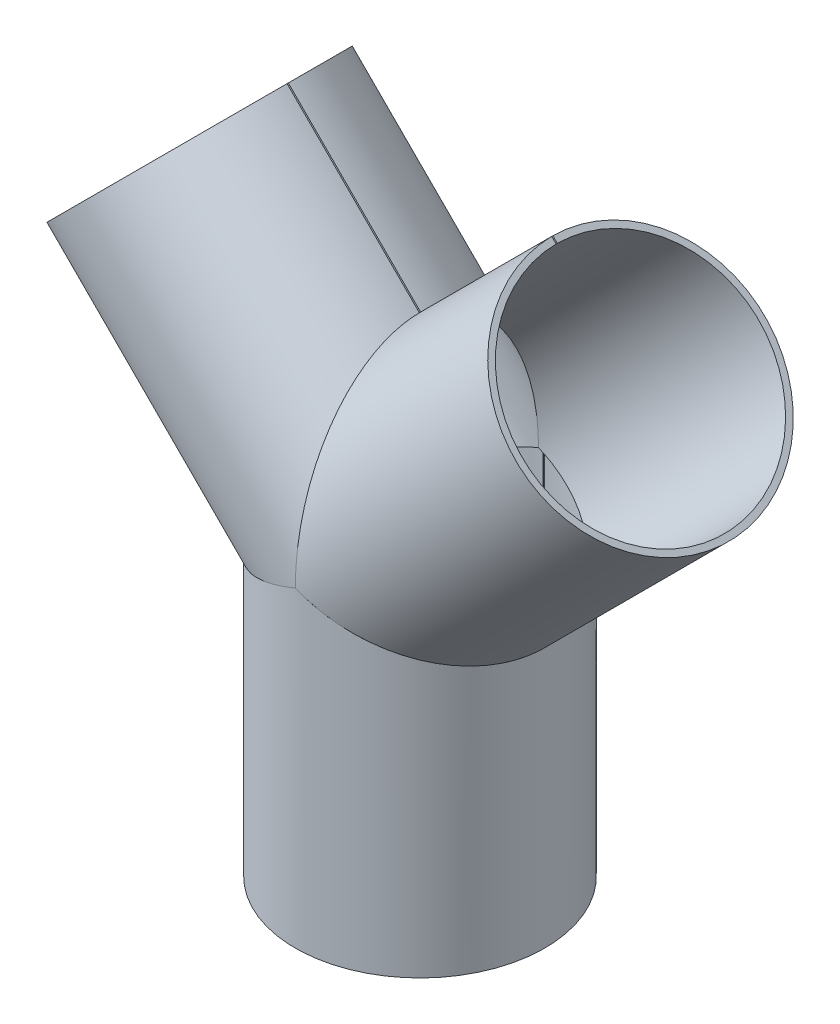
from build123d import *

# Parameters (mm, degrees)
BASE_FLANGE1_START      = -500
BASE_FLANGE1_DEPTH      = 500
CUT_EXTRUDE1_DEPTH      = 729.009787024
CUT_EXTRUDE1_DEPTH_BACK = 729.009787024
BASE_FLANGE2_DEPTH      = 500
CUT_EXTRUDE6_DEPTH      = 729.009787024
CUT_EXTRUDE6_DEPTH_BACK = 729.009787024
BASE_FLANGE3_DEPTH      = 500
CUT_EXTRUDE7_DEPTH      = 732.436941916
CUT_EXTRUDE7_DEPTH_BACK = 732.436941916


# Read off the part's stored shape, not the designer's step: Base-Flange1
# Sheet-metal steps are written as plain solids
with BuildPart() as part:
    # Base-Flange1 outline → Base-Flange1 (new body)
    with BuildSketch(Plane(origin=(353.553390593, 353.553390593, 0), x_dir=(0.7071067811865486, -0.7071067811865465, 0), z_dir=(0.7071067811865465, 0.7071067811865486, 0)).offset(BASE_FLANGE1_START)):
        with BuildLine():
            Line((-189.997625, -0.949997031), (-199.9975, -0.999996875))
            ThreePointArc((-199.9975, -0.999996875), (200, 0), (-199.9975, 0.999996875))
            Line((-199.9975, 0.999996875), (-189.997625, 0.949997031))
            ThreePointArc((-189.997625, 0.949997031), (190, 0), (-189.997625, -0.949997031))
        make_face()
    extrude(amount=BASE_FLANGE1_DEPTH)

    # Sketch7 → Cut-Extrude1 (cut, two sides: drawn at the far end of the back side and taken through both)
    with BuildSketch(Plane.XY.offset(-CUT_EXTRUDE1_DEPTH_BACK)):
        Polygon((141.421356237, -141.421356237), (200, -82.842712475), (0, 0), align=None)
        Polygon((0, 282.839176941), (0, 0), (-141.41958847, 141.41958847), align=None)
    extrude(amount=CUT_EXTRUDE1_DEPTH + CUT_EXTRUDE1_DEPTH_BACK, mode=Mode.SUBTRACT)


with BuildPart() as body_2:
    # Sketch8 → Base-Flange2 (new body)
    with BuildSketch(Plane(origin=(-353.553390593, 353.553390593, 0), x_dir=(0, 0, 1), z_dir=(-0.7071067811865489, 0.7071067811865462, 0))):
        with BuildLine():
            ThreePointArc((-0.999996875, 199.9975), (0, -200), (0.999996875, 199.9975))
            Line((0.999996875, 199.9975), (0.949997031, 189.997625))
            ThreePointArc((0.949997031, 189.997625), (0, -190), (-0.949997031, 189.997625))
            Line((-0.949997031, 189.997625), (-0.999996875, 199.9975))
        make_face()
    extrude(amount=-BASE_FLANGE2_DEPTH)

    # Sketch11 → Cut-Extrude6 (cut, two sides: drawn at the far end of the back side and taken through both)
    with BuildSketch(Plane.XY.offset(-CUT_EXTRUDE6_DEPTH_BACK)):
        Polygon((-141.421356237, -141.421356237), (-200, -82.842712475), (0, 0), align=None)
        Polygon((141.41958847, 141.41958847), (0, 282.839176941), (0, 0), align=None)
    extrude(amount=CUT_EXTRUDE6_DEPTH + CUT_EXTRUDE6_DEPTH_BACK, mode=Mode.SUBTRACT)


with BuildPart() as body_3:
    # Sketch12 → Base-Flange3 (new body)
    with BuildSketch(Plane(origin=(0, -500, 0), x_dir=(1, 0, 0), z_dir=(0, 1, 0))):
        with BuildLine():
            ThreePointArc((-0.999996875, 199.9975), (0, -200), (0.999996875, 199.9975))
            Line((0.999996875, 199.9975), (0.992496898, 198.49751875))
            ThreePointArc((0.992496898, 198.49751875), (0, -198.5), (-0.992496898, 198.49751875))
            Line((-0.992496898, 198.49751875), (-0.999996875, 199.9975))
        make_face()
    extrude(amount=BASE_FLANGE3_DEPTH)

    # Sketch15 → Cut-Extrude7 (cut, two sides: drawn at the far end of the back side and taken through both)
    with BuildSketch(Plane.XY.offset(-CUT_EXTRUDE7_DEPTH_BACK)):
        Polygon((-200, -82.842712475), (0, 0), (-200, 0), align=None)
        Polygon((200, -82.842712475), (200, 0), (0, 0), align=None)
    extrude(amount=CUT_EXTRUDE7_DEPTH + CUT_EXTRUDE7_DEPTH_BACK, mode=Mode.SUBTRACT)


solid = Compound([part.part, body_2.part, body_3.part])
